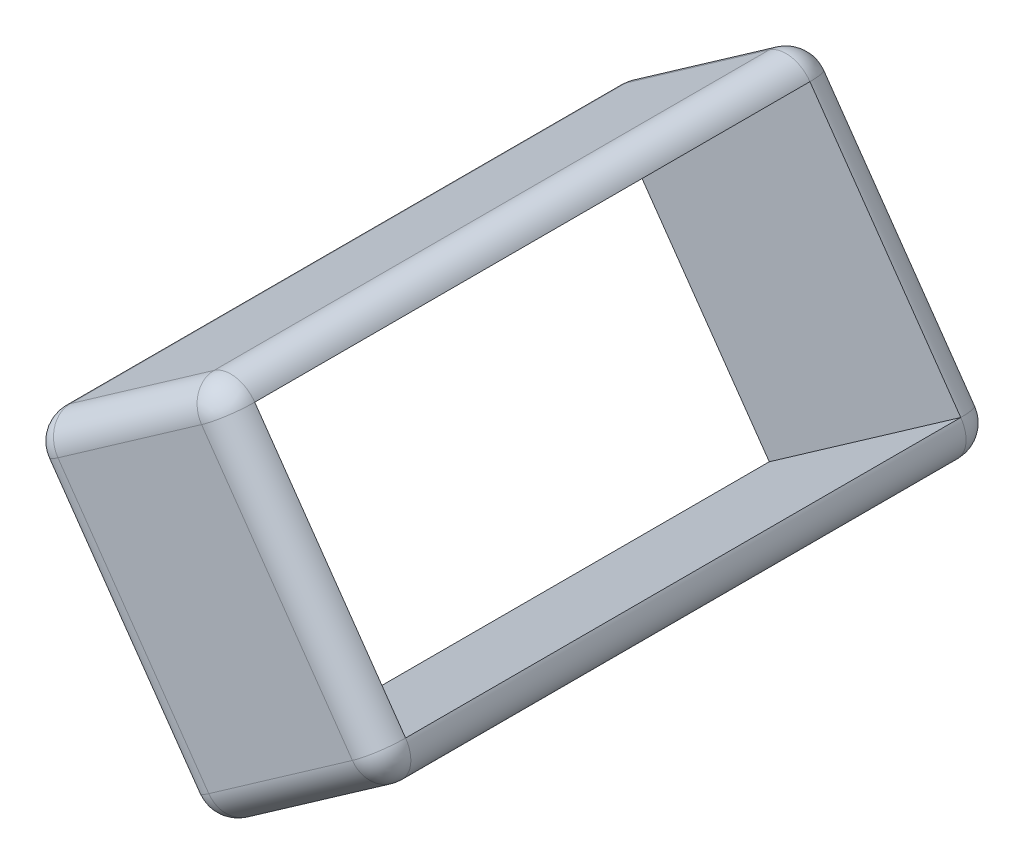
from build123d import *

# Parameters (mm, degrees)
BASE_EXTRUDE_DEPTH = 10.5
FILLET1_R          = 1
SHELL1_START       = 43.20219293
SHELL1_OUTLINE_W   = 8
SHELL1_OUTLINE_H   = 19
SHELL1_DEPTH       = 9


# Read off the part's stored shape, not the designer's step: Shell1
with BuildPart() as part:
    # Sketch1 → Base-Extrude (new, symmetric)
    with BuildSketch(Plane.XY):
        Polygon((17.372143532, -52.78377934), (11.062802732, -43.773106853), (17.616019086, -39.184495362), (23.925359886, -48.195167849), align=None)
    extrude(amount=BASE_EXTRUDE_DEPTH, both=True)

    # Fillet1
    fillet1_edges = [part.edges().sort_by_distance(p)[0] for p in [
        (20.648751709, -50.489473594, 10.5),
        (20.770689486, -43.689831605, 10.5),
        (14.339410909, -41.478801107, 10.5),
        (20.770689486, -43.689831605, -10.5),
        (20.648751709, -50.489473594, -10.5),
        (14.217473132, -48.278443096, -10.5),
        (14.339410909, -41.478801107, -10.5),
        (14.217473132, -48.278443096, 10.5),
        (17.616019086, -39.184495362, 0),
        (23.925359886, -48.195167849, 0),
        (17.372143532, -52.78377934, 0),
        (11.062802732, -43.773106853, 0),
    ]]
    fillet(fillet1_edges, radius=FILLET1_R)

    # Shell1 outline → Shell1 (cut)
    with BuildSketch(Plane(origin=(0, 0, 0), x_dir=(0.8191520442889926, 0.5735764363510448, 0), z_dir=(0.5735764363510448, -0.8191520442889927, 0)).offset(SHELL1_START)):
        with Locations((-12.045105163, 0)):
            Rectangle(SHELL1_OUTLINE_W, SHELL1_OUTLINE_H)
    extrude(amount=SHELL1_DEPTH, mode=Mode.SUBTRACT)


solid = part.part
